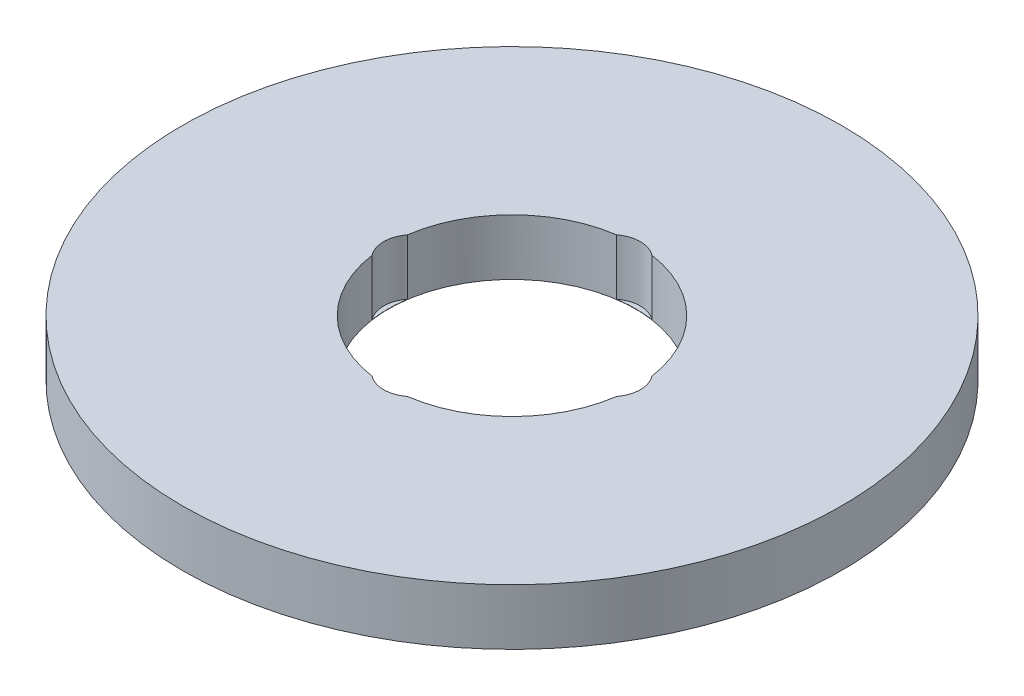
from build123d import *

# Parameters (mm, degrees)
SKETCH1_R           = 100
BOSS_EXTRUDE1_DEPTH = 17
SKETCH2_R           = 37.5
CUT_EXTRUDE1_DEPTH  = 143.439460825
SKETCH3_R           = 8.805795603
CUT_EXTRUDE2_DEPTH  = 16.918082622
CIRPATTERN1_COUNT   = 4


with BuildPart() as part:
    # Sketch1 → Boss-Extrude1 (new body)
    with BuildSketch(Plane(origin=(0, 0, 0), x_dir=(1, 0, 0), z_dir=(0, 1, 0))):
        Circle(SKETCH1_R)
    extrude(amount=BOSS_EXTRUDE1_DEPTH)

    # Sketch2 → Cut-Extrude1 (cut, through all)
    with BuildSketch(Plane(origin=(0, 0, 0), x_dir=(1, 0, 0), z_dir=(0, 1, 0))):
        Circle(SKETCH2_R)
    extrude(amount=CUT_EXTRUDE1_DEPTH, mode=Mode.SUBTRACT)

    # Sketch3 → Cut-Extrude2 (cut)
    with BuildSketch(Plane(origin=(0, 17, 0), x_dir=(1, 0, 0), z_dir=(0, 1, 0))):
        with Locations((-30.12617538, 0)):
            Circle(SKETCH3_R)
    cut_extrude2 = extrude(amount=-CUT_EXTRUDE2_DEPTH, mode=Mode.SUBTRACT)

    # CirPattern1: Cut-Extrude2 ×4 about axis
    cirpattern1_axis = Axis((0, 0, 0), (0, 1, 0))
    for i in range(1, CIRPATTERN1_COUNT):
        add(cut_extrude2.rotate(cirpattern1_axis, i * 360 / CIRPATTERN1_COUNT), mode=Mode.SUBTRACT)


solid = part.part
